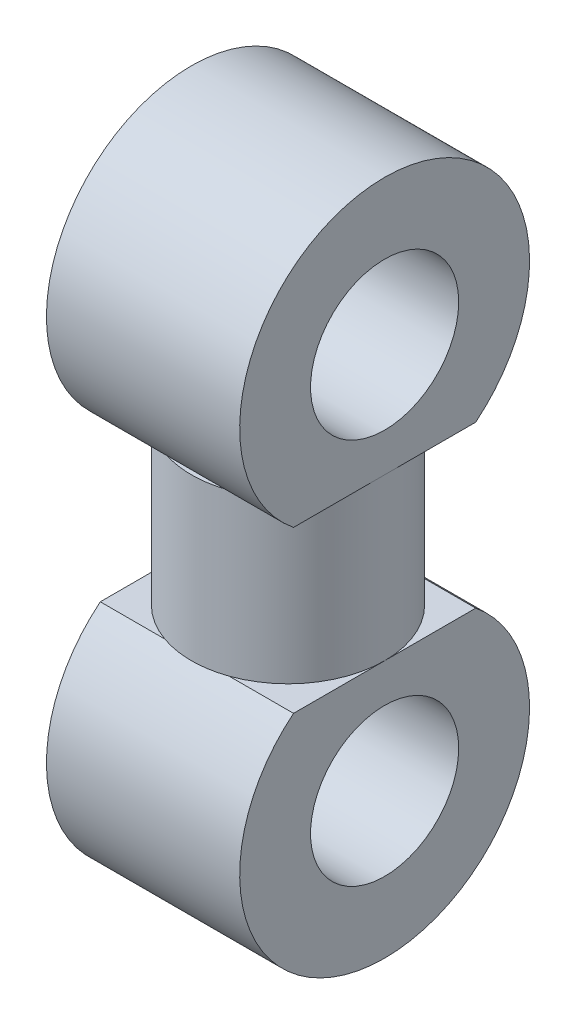
from build123d import *

# Parameters (mm, degrees)
SKETCH1_R            = 3
CRANK_BODY_DEPTH     = 4.5
PIN_SHAFT_BODY_DEPTH = 3
SKETCH4_R            = 2.3
PIN_SHAFT_DEPTH      = 16.00833102
SKETCH1_2_OUTSIDE_W  = 11.382
SKETCH1_2_OUTSIDE_H  = 14.382
SKETCH1_2_OUTSIDE_R  = 3
SMOOTHING_CUTS_DEPTH = 5


with BuildPart() as part:
    # Sketch1 → crank_body (new body)
    with BuildSketch(Plane(origin=(0, 0, 0), x_dir=(1, 0, 0), z_dir=(0, 1, 0))):
        Circle(SKETCH1_R)
    extrude(amount=CRANK_BODY_DEPTH)

    # Sketch3 → pin_shaft_body (add, symmetric)
    with BuildSketch(Plane(origin=(0, 0, 0), x_dir=(0, 0, -1), z_dir=(1, 0, 0))):
        with BuildLine():
            Line((-3, 5), (-3, 4.5))
            Line((-3, 4.5), (3, 4.5))
            Line((3, 4.5), (3, 5))
            Line((3, 5), (2.828427125, 5))
            ThreePointArc((2.828427125, 5), (0, 13), (-2.828427125, 5))
            Line((-2.828427125, 5), (-3, 5))
        make_face()
    pin_shaft_body = extrude(amount=PIN_SHAFT_BODY_DEPTH, both=True)

    # Sketch4 → pin_shaft (cut, through all)
    with BuildSketch(Plane(origin=(3, 0, 0), x_dir=(0, 0, -1), z_dir=(1, 0, 0))):
        with Locations((0, 8.5)):
            Circle(SKETCH4_R)
    pin_shaft = extrude(amount=-PIN_SHAFT_DEPTH, mode=Mode.SUBTRACT)

    # Sketch1<2> outside → smoothing_cuts (cut)
    with BuildSketch(Plane(origin=(0, 0, 0), x_dir=(1, 0, 0), z_dir=(0, 1, 0))):
        Rectangle(SKETCH1_2_OUTSIDE_W, SKETCH1_2_OUTSIDE_H)
        Circle(SKETCH1_2_OUTSIDE_R, mode=Mode.SUBTRACT)
    smoothing_cuts = extrude(amount=SMOOTHING_CUTS_DEPTH, mode=Mode.SUBTRACT)

    # Mirror1: pin_shaft_body, pin_shaft, smoothing_cuts across plane
    add(pin_shaft_body.mirror(Plane(origin=(0, 2.5, 0), x_dir=(0, 0, 1), z_dir=(0, -1, 0))))
    add(pin_shaft.mirror(Plane(origin=(0, 2.5, 0), x_dir=(0, 0, 1), z_dir=(0, -1, 0))), mode=Mode.SUBTRACT)
    add(smoothing_cuts.mirror(Plane(origin=(0, 2.5, 0), x_dir=(0, 0, 1), z_dir=(0, -1, 0))), mode=Mode.SUBTRACT)


solid = part.part
